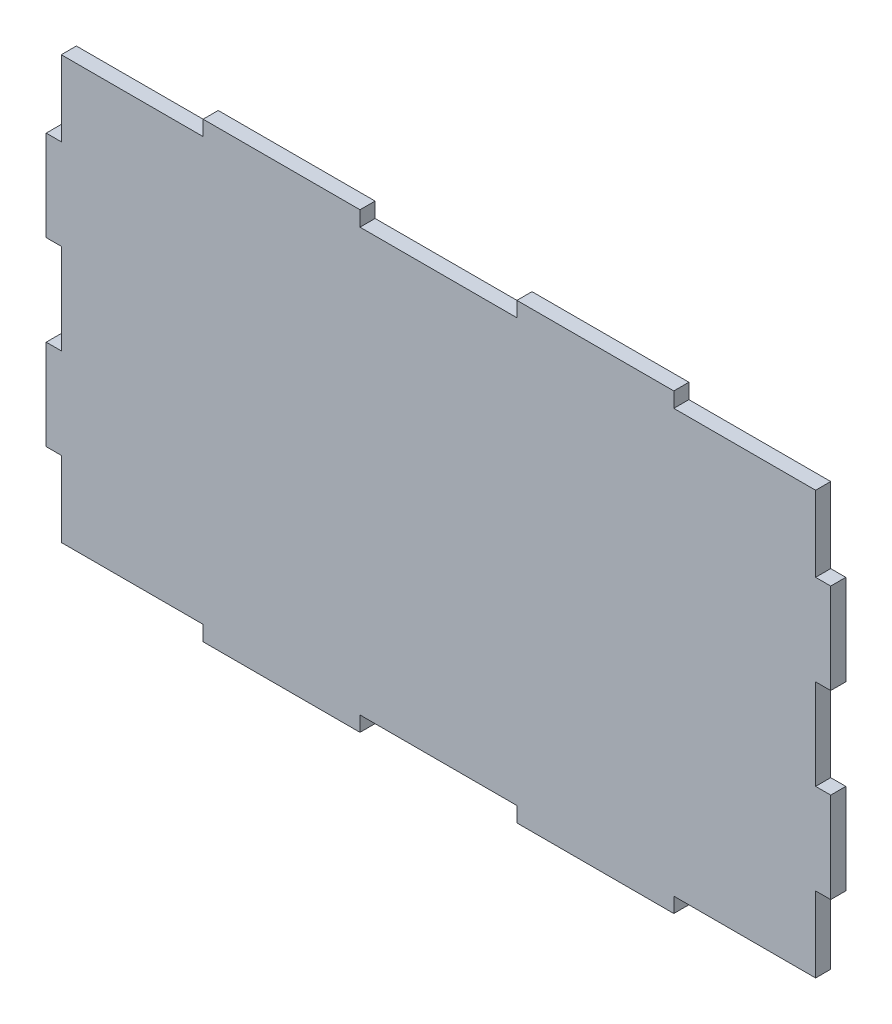
from build123d import *

# Parameters (mm, degrees)
SALIENTE_EXTRUIR1_DEPTH = 5


with BuildPart() as part:
    # Croquis1 → Saliente-Extruir1 (new body)
    with BuildSketch(Plane.XY):
        Polygon((52, 0), (104, 0), (104, 5), (156, 5), (156, 0), (208, 0), (208, 5), (255, 5), (255, 30), (260, 30), (260, 60), (255, 60), (255, 90), (260, 90), (260, 120), (255, 120), (255, 145), (208, 145), (208, 150), (156, 150), (156, 145), (104, 145), (104, 150), (52, 150), (52, 145), (5, 145), (5, 120), (0, 120), (0, 90), (5, 90), (5, 60), (0, 60), (0, 30), (5, 30), (5, 5), (52, 5), align=None)
    extrude(amount=SALIENTE_EXTRUIR1_DEPTH)


solid = part.part
